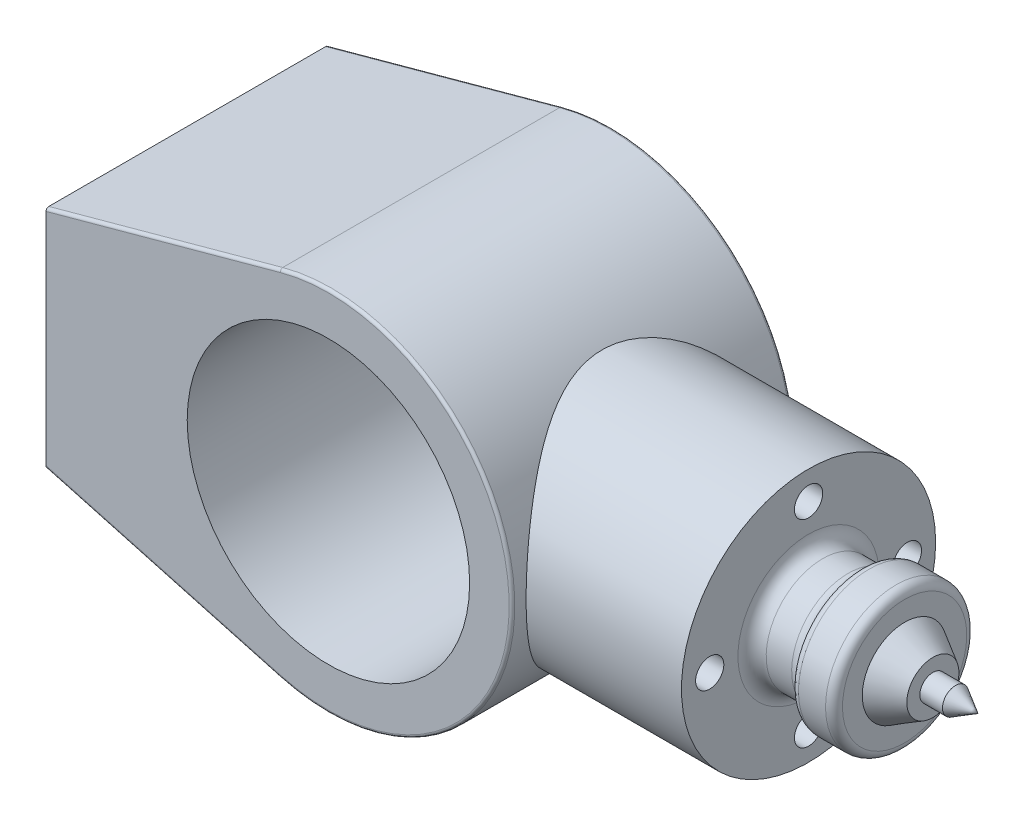
from build123d import *

# Parameters (mm, degrees)
SKETCH1_R                = 50
BOSS_EXTRUDE1_DEPTH      = 50
BOSS_EXTRUDE2_REACH      = 251.325
BOSS_EXTRUDE2_END_RADIUS = 65
BOSS_EXTRUDE2_START      = 120
SKETCH2_R                = 45
SKETCH4_R                = 5
CUT_EXTRUDE1_DEPTH       = 20
FILLET1_R                = 5
FILLET2_R                = 1
FILLET3_R                = 3


with BuildPart() as part:
    # Sketch1 → Boss-Extrude1 (new, symmetric)
    with BuildSketch(Plane.XY):
        with BuildLine():
            Line((-100, -40), (-100, 40))
            Line((-100, 40), (-17.173936855, 62.690157863))
            ThreePointArc((-17.173936855, 62.690157863), (65, 0), (-17.173936855, -62.690157863))
            Line((-17.173936855, -62.690157863), (-100, -40))
        make_face()
        Circle(SKETCH1_R, mode=Mode.SUBTRACT)
    extrude(amount=BOSS_EXTRUDE1_DEPTH, both=True)

    # Boss-Extrude2: up to this cylinder (the profile starts outside it)
    boss_extrude2_end = Plane(origin=(0, 0, 0), z_dir=(0, 0, -1)) * Cylinder(BOSS_EXTRUDE2_END_RADIUS, 633.65, mode=Mode.PRIVATE)
    # Sketch2 → Boss-Extrude2 (add, up to the surface)
    with BuildSketch(Plane(origin=(0, 0, 0), x_dir=(0, 0, -1), z_dir=(1, 0, 0)).offset(BOSS_EXTRUDE2_START), mode=Mode.PRIVATE) as boss_extrude2_sk1:
        Circle(SKETCH2_R)
    boss_extrude2_tool1 = extrude(boss_extrude2_sk1.sketch, amount=-BOSS_EXTRUDE2_REACH, mode=Mode.PRIVATE) - boss_extrude2_end
    add(boss_extrude2_tool1.solids().sort_by_distance((120, 0, 0))[0])

    # Sketch3 → Revolve1 (revolve)
    with BuildSketch(Plane.XY):
        Polygon((120, 0), (180, 0), (172.019237886, -4.607695155), (164.019237886, -4.607695155), (164.019237886, -9.226497308), (154.019237886, -15), (154.019237886, -25), (139.019237886, -25), (139.019237886, -20), (120, -20), align=None)
    revolve(axis=Axis((0, 0, 0), (1, 0, 0)))

    # Sketch4 → Cut-Extrude1 (cut)
    with BuildSketch(Plane(origin=(120, 0, 0), x_dir=(0, 0, -1), z_dir=(1, 0, 0))):
        with Locations((0, 35)):
            Circle(SKETCH4_R)
        with Locations((35, 0)):
            Circle(SKETCH4_R)
        with Locations((0, -35)):
            Circle(SKETCH4_R)
        with Locations((-35, 0)):
            Circle(SKETCH4_R)
    extrude(amount=-CUT_EXTRUDE1_DEPTH, mode=Mode.SUBTRACT)

    # Fillet1
    fillet1_edges = [part.edges().sort_by_distance(p)[0] for p in [
        (120, 20, 0),
        (139.019237886, 20, 0),
    ]]
    fillet(fillet1_edges, radius=FILLET1_R - 0.0001)  # a hair under: the kernel refuses the full size

    # Fillet2
    fillet2_edges = [part.edges().sort_by_distance(p)[0] for p in [
        (-58.586968427, 51.345078932, 50),
        (-58.586968427, -51.345078932, 50),
        (-58.586968427, 51.345078932, -50),
        (65, 0, -50),
        (-58.586968427, -51.345078932, -50),
        (65, 0, 50),
    ]]
    fillet(fillet2_edges, radius=FILLET2_R)

    # Fillet3
    fillet3_edges = [part.edges().sort_by_distance(p)[0] for p in [
        (154.019237886, 25, 0),
        (139.019237886, 25, 0),
    ]]
    fillet(fillet3_edges, radius=FILLET3_R)


solid = part.part
